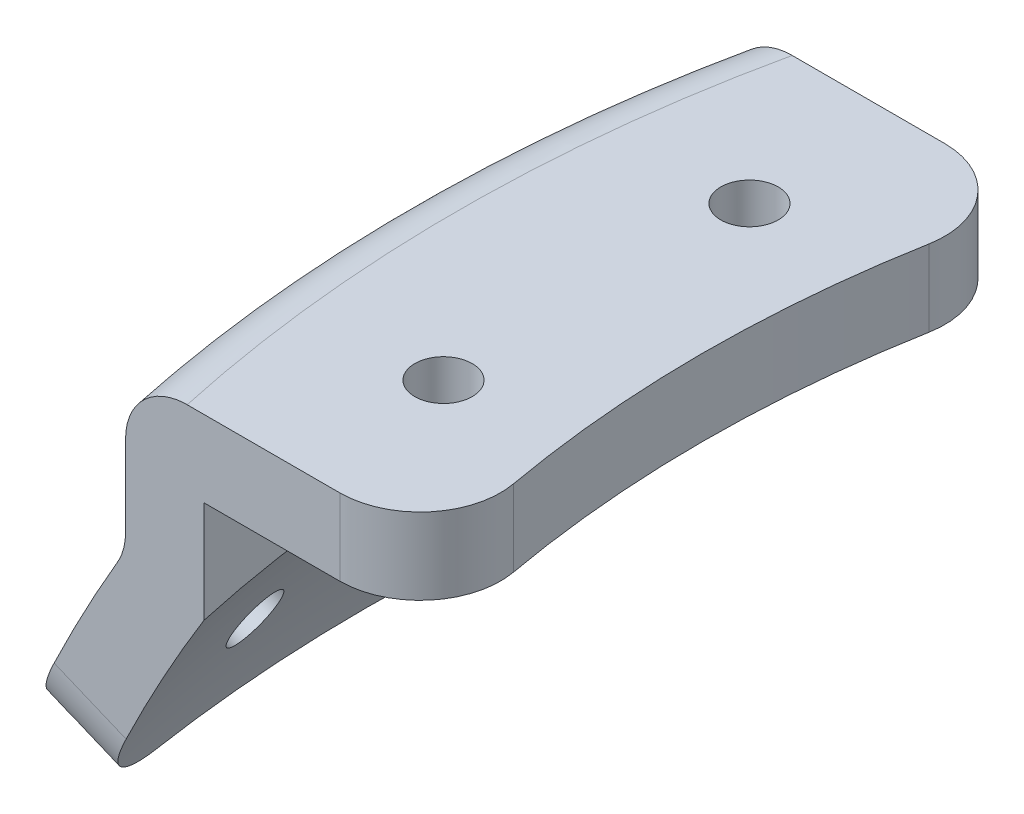
from build123d import *

# Parameters (mm, degrees)
REVOLVE1_ANGLE          = 30
FILLET1_R               = 7.5
CUT_EXTRUDE1_DEPTH      = 207.295163461
CUT_EXTRUDE1_DEPTH_BACK = 207.295163461
SKETCH3_R               = 3.571875
SKETCH4_OUTSIDE_W       = 82.664
SKETCH4_OUTSIDE_H       = 128.62
SKETCH4_OUTSIDE_W_2     = 74.859969382
SKETCH4_OUTSIDE_H_2     = 75.329921726
CUT_EXTRUDE2_DEPTH      = 209.298230862
FILLET2_R               = 10


with BuildPart() as part:
    # Sketch2 → Revolve1 (revolve, symmetric)
    with BuildSketch(Plane.XY) as revolve1_sk:
        with BuildLine():
            Line((-196.144484664, 172.22408059), (-187.361895799, 168.537380464))
            ThreePointArc((-187.361895799, 168.537380464), (-181.203221282, 181.842291517), (-174.101233777, 194.668503093))
            Line((-174.101233777, 194.668503093), (-174.101233777, 207.368503093))
            Line((-174.101233777, 207.368503093), (-145.526233777, 207.368503093))
            Line((-145.526233777, 207.368503093), (-145.526233777, 216.893503093))
            Line((-145.526233777, 216.893503093), (-183.626233777, 216.893503093))
            Line((-183.626233777, 216.893503093), (-183.626233777, 197.281129034))
            ThreePointArc((-183.626233777, 197.281129034), (-190.298222707, 184.958867282), (-196.144484664, 172.22408059))
        make_face()
    revolve(axis=Axis((0, 0, 0), (0, 1, 0)), revolution_arc=REVOLVE1_ANGLE / 2)
    revolve(revolve1_sk.sketch, axis=Axis((0, 0, 0), (0, -1, 0)), revolution_arc=REVOLVE1_ANGLE / 2)

    # Fillet1
    fillet1_edges = [part.edges().sort_by_distance(p)[0] for p in [
        (-183.626233777, 197.281129034, 0),
        (-183.626233777, 216.893503093, 0),
    ]]
    fillet(fillet1_edges, radius=FILLET1_R)

    # Sketch3 → Cut-Extrude1 (cut, two sides: drawn at the far end of the back side and taken through both)
    with BuildSketch(Plane.XZ.offset(-207.368503093).offset(-CUT_EXTRUDE1_DEPTH_BACK)):
        with Locations((-158.75, 19.05)):
            Circle(SKETCH3_R)
        with Locations((-158.75, -19.05)):
            Circle(SKETCH3_R)
    extrude(amount=CUT_EXTRUDE1_DEPTH + CUT_EXTRUDE1_DEPTH_BACK, mode=Mode.SUBTRACT)

    # Sketch4 outside → Cut-Extrude2 (cut, through all)
    with BuildSketch(Plane(origin=(0, 216.893503093, 0), x_dir=(1, 0, 0), z_dir=(0, 1, 0))):
        with Locations((-168.356, 0)):
            Rectangle(SKETCH4_OUTSIDE_W, SKETCH4_OUTSIDE_H)
        with Locations((-177.997532298, 0)):
            Rectangle(SKETCH4_OUTSIDE_W_2, SKETCH4_OUTSIDE_H_2, mode=Mode.SUBTRACT)
    extrude(amount=-CUT_EXTRUDE2_DEPTH, mode=Mode.SUBTRACT)

    # Fillet2
    fillet2_edges = [part.edges().sort_by_distance(p)[0] for p in [
        (-188.015889107, 170.380005777, 37.664960863),
        (-188.015889107, 170.380005777, -37.664960863),
        (-140.567547607, 212.131003093, -37.664960863),
        (-140.567547607, 212.131003093, 37.664960863),
    ]]
    fillet(fillet2_edges, radius=FILLET2_R)

    # Sketch6 → Cut-Revolve1 (revolve, cut)
    with BuildSketch(Plane(origin=(36.360369904, 71.361243959, 0), x_dir=(-0.8910065241883691, 0.4539904997395443, 0), z_dir=(0.4539904997395443, 0.8910065241883691, 0))):
        Polygon((216.837700771, 18.970840643), (271.242197983, 23.730617393), (270.930888565, 27.288900331), (216.526391353, 22.52912358), align=None)
    cut_revolve1 = revolve(axis=Axis((-156.843436173, 169.803500094, 18.970840643), (-0.887615975361608, 0.4522629288245561, 0.08715574274765836)), mode=Mode.SUBTRACT)

    # Mirror1: Cut-Revolve1 across plane
    add(cut_revolve1.mirror(Plane.XY), mode=Mode.SUBTRACT)


solid = part.part
